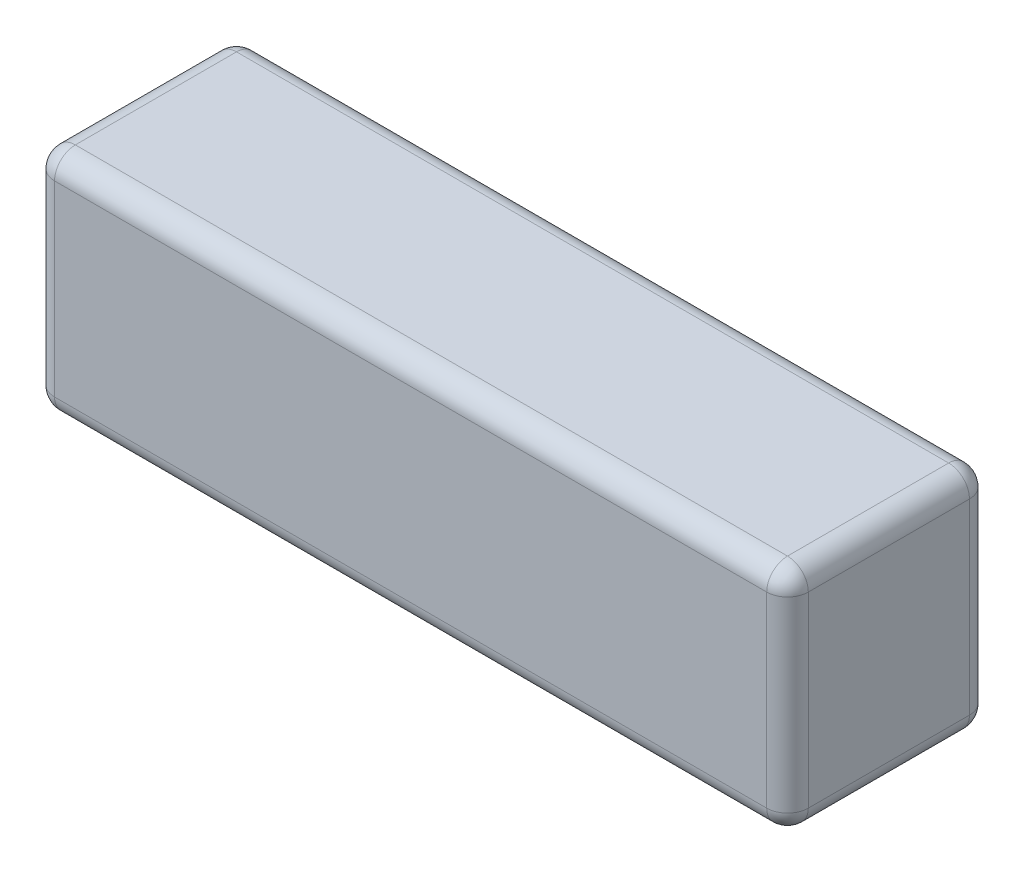
from build123d import *

# Parameters (mm, degrees)
SKETCH1_W           = 145
SKETCH1_H           = 39
BOSS_EXTRUDE1_DEPTH = 44
FILLET1_R           = 4


with BuildPart() as part:
    # Sketch1 → Boss-Extrude1 (new body)
    with BuildSketch(Plane(origin=(0, 0, 0), x_dir=(1, 0, 0), z_dir=(0, 1, 0))):
        Rectangle(SKETCH1_W, SKETCH1_H)
    extrude(amount=BOSS_EXTRUDE1_DEPTH)

    # Fillet1
    fillet1_edges = [part.edges().sort_by_distance(p)[0] for p in [
        (72.5, 22, 19.5),
        (72.5, 44, 0),
        (72.5, 22, -19.5),
        (72.5, 0, 0),
        (-72.5, 22, -19.5),
        (0, 0, -19.5),
        (-72.5, 0, 0),
        (-72.5, 22, 19.5),
        (0, 0, 19.5),
        (0, 44, 19.5),
        (-72.5, 44, 0),
        (0, 44, -19.5),
    ]]
    fillet(fillet1_edges, radius=FILLET1_R)


solid = part.part
